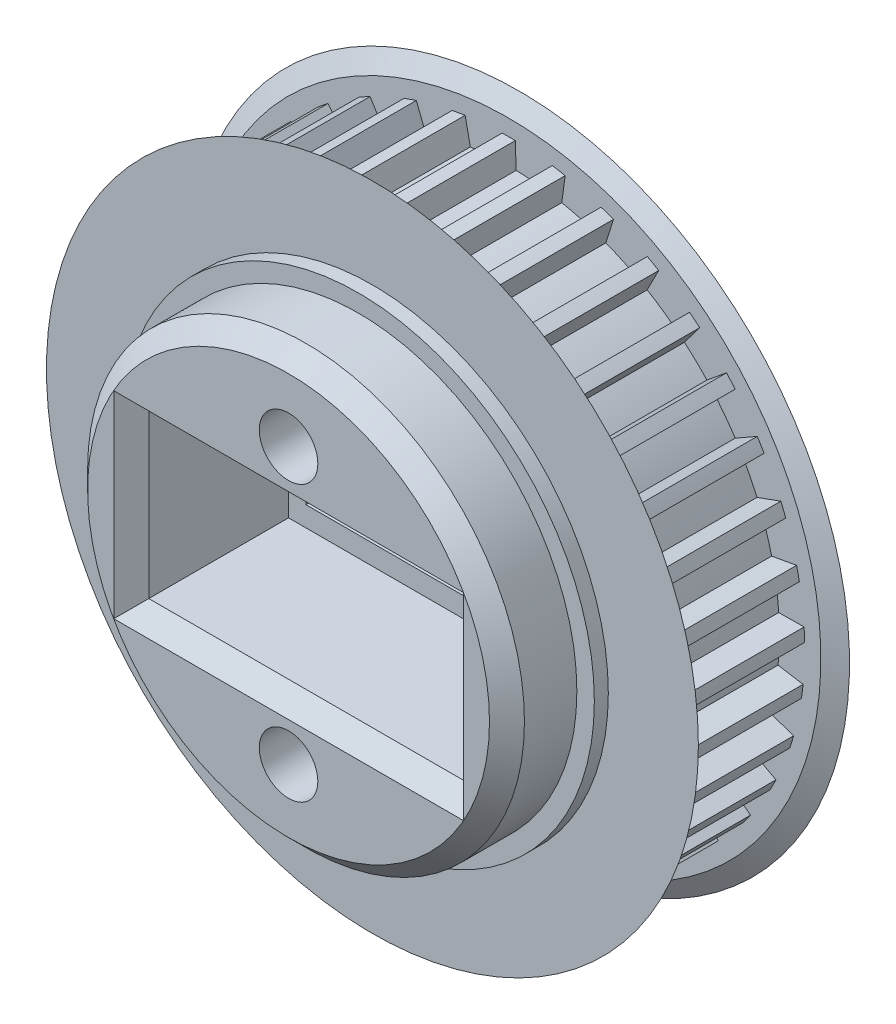
from build123d import *
from build123d.topology import SkipClean

# Parameters (mm, degrees)
CROQUIS1_R                 = 2
SALIENTE_EXTRUIR1_DEPTH    = 7.2
CROQUIS2_R                 = 19
CROQUIS2_R_2               = 2
SALIENTE_EXTRUIR2_DEPTH    = 0.6
SALIENTE_EXTRUIR4_START    = 5.8
CROQUIS4_R                 = 12.45
CROQUIS4_R_2               = 2
SALIENTE_EXTRUIR4_DEPTH    = 5.8
SALIENTE_EXTRUIR6_START    = 0.6
CROQUIS6_R                 = 19.25
CROQUIS6_R_2               = 2
SALIENTE_EXTRUIR6_DEPTH    = 0.6
SALIENTE_EXTRUIR5_START    = 0.6
CROQUIS5_R                 = 13.5
CROQUIS5_R_2               = 2
SALIENTE_EXTRUIR5_DEPTH    = 0.6
CHAFL_N2_SIZE              = 1.385640646
CHAFL_N2_SIZE_2            = 0.8
CROQUIS3_R                 = 12.5
CROQUIS3_R_2               = 2
SALIENTE_EXTRUIR7_DEPTH    = 4.8
CHAFL_N4_SIZE              = 1
CROQUIS7_R                 = 13.5
CROQUIS7_R_2               = 2
SALIENTE_EXTRUIR8_DEPTH    = 0.8
CORTAR_EXTRUIR1_DEPTH      = 30.554211503
CORTAR_EXTRUIR1_DEPTH_BACK = 30.554211503
CROQUIS8_R                 = 1.675
CROQUIS8_W                 = 16
CROQUIS8_H                 = 7
CORTAR_EXTRUIR2_DEPTH      = 4
REDONDEO1_R                = 2.5
CROQUIS10_W                = 18
CROQUIS10_H                = 9.3
CORTAR_EXTRUIR3_DEPTH      = 9
CHAFL_N5_SIZE              = 1


with BuildPart() as part:
    # Croquis1 → Saliente-Extruir1 (new body)
    with BuildSketch(Plane.XY):
        with BuildLine():
            Line((-0.375, 16.933844216), (-0.425, 15.482163668))
            ThreePointArc((-0.425, 15.482163668), (-1.31347381, 15.432200212), (-2.197611598, 15.331292186))
            Line((-2.197611598, 15.331292186), (-2.492227597, 16.75364159))
            Line((-2.492227597, 16.75364159), (-3.23143953, 16.626890975))
            Line((-3.23143953, 16.626890975), (-3.035385122, 15.187641489))
            ThreePointArc((-3.035385122, 15.187641489), (-3.90263518, 14.988243909), (-4.757001912, 14.739367342))
            Line((-4.757001912, 14.739367342), (-5.287758344, 16.091467199))
            ThreePointArc((-5.287758344, 16.091467199), (-5.642720476, 15.970454301), (-5.994916428, 15.841612353))
            Line((-5.994916428, 15.841612353), (-5.558447741, 14.456198517))
            ThreePointArc((-5.558447741, 14.456198517), (-6.379524842, 14.113103118), (-7.179541942, 13.723417735))
            Line((-7.179541942, 13.723417735), (-7.931169911, 14.966370595))
            ThreePointArc((-7.931169911, 14.966370595), (-8.260574956, 14.787109465), (-8.585930496, 14.600599387))
            Line((-8.585930496, 14.600599387), (-7.921603938, 13.308877033))
            ThreePointArc((-7.921603938, 13.308877033), (-8.672887189, 12.831954046), (-9.395539622, 12.312670387))
            Line((-9.395539622, 12.312670387), (-10.34641616, 13.410718757))
            ThreePointArc((-10.34641616, 13.410718757), (-10.640787735, 13.178366413), (-10.929942975, 12.939553759))
            Line((-10.929942975, 12.939553759), (-10.056870013, 11.778683389))
            ThreePointArc((-10.056870013, 11.778683389), (-10.716746362, 11.181653019), (-11.341244733, 10.547709928))
            Line((-11.341244733, 10.547709928), (-12.464014853, 11.469264958))
            ThreePointArc((-12.464014853, 11.469264958), (-12.714884425, 11.190505753), (-12.959520896, 10.906260729))
            Line((-12.959520896, 10.906260729), (-11.902818248, 9.909638469))
            ThreePointArc((-11.902818248, 9.909638469), (-12.452304255, 9.209676194), (-12.960682883, 8.47931106))
            Line((-12.960682883, 8.47931106), (-14.223046532, 9.197861288))
            ThreePointArc((-14.223046532, 9.197861288), (-14.423197039, 8.880714617), (-14.616276995, 8.559214434))
            Line((-14.616276995, 8.559214434), (-13.406344074, 7.755511293))
            ThreePointArc((-13.406344074, 7.755511293), (-13.829632025, 6.972753752), (-14.207265783, 6.16697785))
            Line((-14.207265783, 6.16697785), (-15.572907059, 6.661851895))
            ThreePointArc((-15.572907059, 6.661851895), (-15.716580535, 6.31544149), (-15.852549417, 5.965935124))
            Line((-15.852549417, 5.965935124), (-14.524193789, 5.378272177))
            ThreePointArc((-14.524193789, 5.378272177), (-14.809106462, 4.535237879), (-15.045131514, 3.677231916))
            Line((-15.045131514, 3.677231916), (-16.474763403, 3.934193152))
            ThreePointArc((-16.474763403, 3.934193152), (-16.557826624, 3.56848461), (-16.632772855, 3.201026723))
            Line((-16.632772855, 3.201026723), (-15.224208894, 2.846309963))
            ThreePointArc((-15.224208894, 2.846309963), (-15.362549869, 1.967251471), (-15.450176204, 1.081698715))
            Line((-15.450176204, 1.081698715), (-16.902670799, 1.093354836))
            ThreePointArc((-16.902670799, 1.093354836), (-16.922734188, 0.718868926), (-16.934501701, 0.344030611))
            Line((-16.934501701, 0.344030611), (-15.486251227, 0.232464594))
            ThreePointArc((-15.486251227, 0.232464594), (-15.474040687, -0.657329181), (-15.410747454, -1.544952989))
            Line((-15.410747454, -1.544952989), (-16.844319131, -1.778937309))
            ThreePointArc((-16.844319131, -1.778937309), (-16.800805501, -2.151427309), (-16.749055766, -2.522862635))
            Line((-16.749055766, -2.522862635), (-15.302782308, -2.388068359))
            ThreePointArc((-15.302782308, -2.388068359), (-15.140371528, -3.262999669), (-14.927979559, -4.127159208))
            Line((-14.927979559, -4.127159208), (-16.30138707, -4.600052666))
            ThreePointArc((-16.30138707, -4.600052666), (-16.195548228, -4.959830898), (-16.081769991, -5.317177717))
            Line((-16.081769991, -5.317177717), (-14.679080203, -4.939900933))
            ThreePointArc((-14.679080203, -4.939900933), (-14.371141446, -5.774799597), (-14.015760871, -6.590634571))
            Line((-14.015760871, -6.590634571), (-15.289493783, -7.288832883))
            ThreePointArc((-15.289493783, -7.288832883), (-15.12437452, -7.625549182), (-14.951840974, -7.958527277))
            Line((-14.951840974, -7.958527277), (-13.633087688, -7.349621551))
            ThreePointArc((-13.633087688, -7.349621551), (-13.18847979, -8.120469055), (-12.700334261, -8.864509377))
            Line((-12.700334261, -8.864509377), (-13.837749597, -9.767926649))
            ThreePointArc((-13.837749597, -9.767926649), (-13.618100094, -10.071894299), (-13.391774715, -10.370924497))
            Line((-13.391774715, -10.370924497), (-12.194896061, -9.547906938))
            ThreePointArc((-12.194896061, -9.547906938), (-11.626409582, -10.232527404), (-11.019542158, -10.883368388))
            Line((-11.019542158, -10.883368388), (-11.98791855, -11.96601495))
            ThreePointArc((-11.98791855, -11.96601495), (-11.720057722, -12.228489356), (-11.446451479, -12.484969102))
            Line((-11.446451479, -12.484969102), (-10.405879478, -11.471516427))
            ThreePointArc((-10.405879478, -11.471516427), (-9.729868739, -12.050214569), (-9.02173789, -12.589132706))
            Line((-9.02173789, -12.589132706), (-9.793216912, -13.819862787))
            ThreePointArc((-9.793216912, -13.819862787), (-9.484850629, -14.033293038), (-9.171834675, -14.239843877))
            Line((-9.171834675, -14.239843877), (-8.317504688, -13.065111274))
            ThreePointArc((-8.317504688, -13.065111274), (-7.553417288, -13.521239001), (-6.764394649, -13.932730597))
            Line((-6.764394649, -13.932730597), (-7.316782254, -15.276138333))
            ThreePointArc((-7.316782254, -15.276138333), (-6.976781652, -15.434384429), (-6.633360886, -15.58506427))
            Line((-6.633360886, -15.58506427), (-5.989850432, -14.282846658))
            ThreePointArc((-5.989850432, -14.282846658), (-5.159667773, -14.603282005), (-4.31245209, -14.875509195))
            Line((-4.31245209, -14.875509195), (-4.629857092, -16.292947193))
            ThreePointArc((-4.629857092, -16.292947193), (-4.268003369, -16.391456682), (-3.904057382, -16.481930739))
            Line((-3.904057382, -16.481930739), (-3.489879085, -15.089690547))
            ThreePointArc((-3.489879085, -15.089690547), (-2.617484011, -15.265215173), (-1.736448135, -15.390346478))
            Line((-1.736448135, -15.390346478), (-1.809739372, -16.841037627))
            ThreePointArc((-1.809739372, -16.841037627), (-1.436442401, -16.876976571), (-1.062441255, -16.90464207))
            Line((-1.062441255, -16.90464207), (-0.88951027, -15.462431514))
            ThreePointArc((-0.88951027, -15.462431514), (0, -15.487995895), (0.88951027, -15.462431514))
            Line((0.88951027, -15.462431514), (1.062441255, -16.90464207))
            ThreePointArc((1.062441255, -16.90464207), (1.436442401, -16.876976571), (1.809739372, -16.841037627))
            Line((1.809739372, -16.841037627), (1.736448135, -15.390346478))
            ThreePointArc((1.736448135, -15.390346478), (2.617484011, -15.265215173), (3.489879085, -15.089690547))
            Line((3.489879085, -15.089690547), (3.904057382, -16.481930739))
            ThreePointArc((3.904057382, -16.481930739), (4.268003369, -16.391456682), (4.629857092, -16.292947193))
            Line((4.629857092, -16.292947193), (4.31245209, -14.875509195))
            ThreePointArc((4.31245209, -14.875509195), (5.159667773, -14.603282005), (5.989850432, -14.282846658))
            Line((5.989850432, -14.282846658), (6.633360886, -15.58506427))
            ThreePointArc((6.633360886, -15.58506427), (6.976781652, -15.434384429), (7.316782254, -15.276138333))
            Line((7.316782254, -15.276138333), (6.764394649, -13.932730597))
            ThreePointArc((6.764394649, -13.932730597), (7.553417288, -13.521239001), (8.317504688, -13.065111274))
            Line((8.317504688, -13.065111274), (9.171834675, -14.239843877))
            ThreePointArc((9.171834675, -14.239843877), (9.484850629, -14.033293038), (9.793216912, -13.819862787))
            Line((9.793216912, -13.819862787), (9.02173789, -12.589132706))
            ThreePointArc((9.02173789, -12.589132706), (9.729868739, -12.050214569), (10.405879478, -11.471516427))
            Line((10.405879478, -11.471516427), (11.446451479, -12.484969102))
            ThreePointArc((11.446451479, -12.484969102), (11.720057722, -12.228489356), (11.98791855, -11.96601495))
            Line((11.98791855, -11.96601495), (11.019542158, -10.883368388))
            ThreePointArc((11.019542158, -10.883368388), (11.626409582, -10.232527404), (12.194896061, -9.547906938))
            Line((12.194896061, -9.547906938), (13.391774715, -10.370924497))
            ThreePointArc((13.391774715, -10.370924497), (13.618100094, -10.071894299), (13.837749597, -9.767926649))
            Line((13.837749597, -9.767926649), (12.700334261, -8.864509377))
            ThreePointArc((12.700334261, -8.864509377), (13.18847979, -8.120469055), (13.633087688, -7.349621551))
            Line((13.633087688, -7.349621551), (14.951840974, -7.958527277))
            ThreePointArc((14.951840974, -7.958527277), (15.12437452, -7.625549182), (15.289493783, -7.288832883))
            Line((15.289493783, -7.288832883), (14.015760871, -6.590634571))
            ThreePointArc((14.015760871, -6.590634571), (14.371141446, -5.774799597), (14.679080203, -4.939900933))
            Line((14.679080203, -4.939900933), (16.081769991, -5.317177717))
            ThreePointArc((16.081769991, -5.317177717), (16.195548228, -4.959830898), (16.30138707, -4.600052666))
            Line((16.30138707, -4.600052666), (14.927979559, -4.127159208))
            ThreePointArc((14.927979559, -4.127159208), (15.140371528, -3.262999669), (15.302782308, -2.388068359))
            Line((15.302782308, -2.388068359), (16.749055766, -2.522862635))
            ThreePointArc((16.749055766, -2.522862635), (16.800805501, -2.151427309), (16.844319131, -1.778937309))
            Line((16.844319131, -1.778937309), (15.410747454, -1.544952989))
            ThreePointArc((15.410747454, -1.544952989), (15.474040687, -0.657329181), (15.486251227, 0.232464594))
            Line((15.486251227, 0.232464594), (16.934501701, 0.344030611))
            ThreePointArc((16.934501701, 0.344030611), (16.922734188, 0.718868926), (16.902670799, 1.093354836))
            Line((16.902670799, 1.093354836), (15.450176204, 1.081698715))
            ThreePointArc((15.450176204, 1.081698715), (15.362549869, 1.967251471), (15.224208894, 2.846309963))
            Line((15.224208894, 2.846309963), (16.632772855, 3.201026723))
            ThreePointArc((16.632772855, 3.201026723), (16.557826624, 3.56848461), (16.474763403, 3.934193152))
            Line((16.474763403, 3.934193152), (15.045131514, 3.677231916))
            ThreePointArc((15.045131514, 3.677231916), (14.809106462, 4.535237879), (14.524193789, 5.378272177))
            Line((14.524193789, 5.378272177), (15.852549417, 5.965935124))
            ThreePointArc((15.852549417, 5.965935124), (15.716580535, 6.31544149), (15.572907059, 6.661851895))
            Line((15.572907059, 6.661851895), (14.207265783, 6.16697785))
            ThreePointArc((14.207265783, 6.16697785), (13.829632025, 6.972753752), (13.406344074, 7.755511293))
            Line((13.406344074, 7.755511293), (14.616276995, 8.559214434))
            ThreePointArc((14.616276995, 8.559214434), (14.423197039, 8.880714617), (14.223046532, 9.197861288))
            Line((14.223046532, 9.197861288), (12.960682883, 8.47931106))
            ThreePointArc((12.960682883, 8.47931106), (12.452304255, 9.209676194), (11.902818248, 9.909638469))
            Line((11.902818248, 9.909638469), (12.959520896, 10.906260729))
            ThreePointArc((12.959520896, 10.906260729), (12.714884425, 11.190505753), (12.464014853, 11.469264958))
            Line((12.464014853, 11.469264958), (11.341244733, 10.547709928))
            ThreePointArc((11.341244733, 10.547709928), (10.716746362, 11.181653019), (10.056870013, 11.778683389))
            Line((10.056870013, 11.778683389), (10.929942975, 12.939553759))
            ThreePointArc((10.929942975, 12.939553759), (10.640787735, 13.178366413), (10.34641616, 13.410718757))
            Line((10.34641616, 13.410718757), (9.395539622, 12.312670387))
            ThreePointArc((9.395539622, 12.312670387), (8.672887189, 12.831954046), (7.921603938, 13.308877033))
            Line((7.921603938, 13.308877033), (8.585930496, 14.600599387))
            ThreePointArc((8.585930496, 14.600599387), (8.260574956, 14.787109465), (7.931169911, 14.966370595))
            Line((7.931169911, 14.966370595), (7.179541942, 13.723417735))
            ThreePointArc((7.179541942, 13.723417735), (6.379524842, 14.113103118), (5.558447741, 14.456198517))
            Line((5.558447741, 14.456198517), (5.994916428, 15.841612353))
            ThreePointArc((5.994916428, 15.841612353), (5.642720476, 15.970454301), (5.287758344, 16.091467199))
            Line((5.287758344, 16.091467199), (4.757001912, 14.739367342))
            ThreePointArc((4.757001912, 14.739367342), (3.90263518, 14.988243909), (3.035385122, 15.187641489))
            Line((3.035385122, 15.187641489), (3.23143953, 16.626890975))
            ThreePointArc((3.23143953, 16.626890975), (2.862535201, 16.694358243), (2.492227597, 16.75364159))
            Line((2.492227597, 16.75364159), (2.197611598, 15.331292186))
            ThreePointArc((2.197611598, 15.331292186), (1.31347381, 15.432200212), (0.425, 15.482163668))
            Line((0.425, 15.482163668), (0.375, 16.933844216))
            ThreePointArc((0.375, 16.933844216), (0, 16.937995895), (-0.375, 16.933844216))
        make_face()
        Circle(CROQUIS1_R, mode=Mode.SUBTRACT)
    extrude(amount=SALIENTE_EXTRUIR1_DEPTH)

    # Croquis2 → Saliente-Extruir2 (add)
    with BuildSketch(Plane.XY.offset(7.2)):
        Circle(CROQUIS2_R)
        Circle(CROQUIS2_R_2, mode=Mode.SUBTRACT)
    extrude(amount=SALIENTE_EXTRUIR2_DEPTH)

    # Croquis4 → Saliente-Extruir4 (add)
    with BuildSketch(Plane(origin=(0, 0, 0), x_dir=(-1, 0, 0), z_dir=(0, 0, -1)).offset(SALIENTE_EXTRUIR4_START)):
        with Locations(Location((0, 0, 0), (0, 0, 180))):
            Circle(CROQUIS4_R)
        Circle(CROQUIS4_R_2, mode=Mode.SUBTRACT)
    extrude(amount=-SALIENTE_EXTRUIR4_DEPTH)

    # Croquis6 → Saliente-Extruir6 (add)
    with SkipClean():  # the faces are left unmerged after this step: merging them gives an invalid solid
        with BuildSketch(Plane(origin=(0, 0, 0), x_dir=(-1, 0, 0), z_dir=(0, 0, -1)).offset(SALIENTE_EXTRUIR6_START)):
            Circle(CROQUIS6_R)
            Circle(CROQUIS6_R_2, mode=Mode.SUBTRACT)
        extrude(amount=-SALIENTE_EXTRUIR6_DEPTH)

    # Croquis5 → Saliente-Extruir5 (add)
    with SkipClean():  # the faces are left unmerged after this step: merging them gives an invalid solid
        with BuildSketch(Plane(origin=(0, 0, -0.6), x_dir=(-1, 0, 0), z_dir=(0, 0, -1)).offset(SALIENTE_EXTRUIR5_START)):
            Circle(CROQUIS5_R)
            Circle(CROQUIS5_R_2, mode=Mode.SUBTRACT)
        extrude(amount=-SALIENTE_EXTRUIR5_DEPTH)

    # Chaflán2
    # the kernel refuses this chamfer: 1.385640646, 0.8 mm, written as the material it takes off along each edge
    with BuildSketch(Plane(origin=(0, 0, 0), x_dir=(-1, 0, 0), z_dir=(0, -1, 0))) as chafl_n2_piece_1:
        Polygon((19.25 - CHAFL_N2_SIZE, 0), (19.25, CHAFL_N2_SIZE_2), (19.25, 0), align=None)
    revolve(axis=Axis((0, 0, 0), (0, 0, -1)), mode=Mode.SUBTRACT)
    with BuildSketch(Plane(origin=(0, 0, 7.2), x_dir=(1, 0, 0), z_dir=(0, -1, 0))) as chafl_n2_piece_2:
        Polygon((19 - CHAFL_N2_SIZE, 0), (19, CHAFL_N2_SIZE_2), (19, 0), align=None)
    revolve(axis=Axis((0, 0, 7.2), (0, 0, 1)), mode=Mode.SUBTRACT)

    # Croquis3 → Saliente-Extruir7 (add)
    with BuildSketch(Plane.XY.offset(7.8)):
        Circle(CROQUIS3_R)
        with Locations(Location((0, 0, 0), (0, 0, 180))):
            Circle(CROQUIS3_R_2, mode=Mode.SUBTRACT)
    extrude(amount=SALIENTE_EXTRUIR7_DEPTH)

    # Chaflán4
    chafl_n4_edges = [part.edges().sort_by_distance(p)[0] for p in [
        (-12.45, 0, -5.8),
        (-12.5, 0, 12.6),
    ]]
    chamfer(chafl_n4_edges, length=CHAFL_N4_SIZE)

    # Croquis7 → Saliente-Extruir8 (add)
    with BuildSketch(Plane.XY.offset(7.8)):
        with Locations(Location((0, 0, 0), (0, 0, 180))):
            Circle(CROQUIS7_R)
        with Locations(Location((0, 0, 0), (0, 0, 180))):
            Circle(CROQUIS7_R_2, mode=Mode.SUBTRACT)
    extrude(amount=SALIENTE_EXTRUIR8_DEPTH)

    # Croquis8 → Cortar-Extruir1 (cut, two sides: drawn at the far end of the back side and taken through both)
    with BuildSketch(Plane.XY.offset(-CORTAR_EXTRUIR1_DEPTH_BACK)):
        with Locations((0, 7.875631857)):
            Circle(CROQUIS8_R)
        with Locations((0, -7.875631857)):
            Circle(CROQUIS8_R)
        Rectangle(CROQUIS8_W, CROQUIS8_H)
    extrude(amount=CORTAR_EXTRUIR1_DEPTH + CORTAR_EXTRUIR1_DEPTH_BACK, mode=Mode.SUBTRACT)

    # Croquis9 → Cortar-Extruir2 (cut)
    with BuildSketch(Plane(origin=(0, 0, -5.8), x_dir=(-1, 0, 0), z_dir=(0, 0, -1))):
        Polygon((2.33826859, 3.825631857), (4.67653718, 7.875631857), (2.33826859, 11.925631857), (-2.33826859, 11.925631857), (-4.67653718, 7.875631857), (-2.33826859, 3.825631857), align=None)
        Polygon((2.33826859, -11.925631857), (4.67653718, -7.875631857), (2.33826859, -3.825631857), (-2.33826859, -3.825631857), (-4.67653718, -7.875631857), (-2.33826859, -11.925631857), align=None)
    extrude(amount=-CORTAR_EXTRUIR2_DEPTH, mode=Mode.SUBTRACT)

    # Redondeo1
    redondeo1_edges = [part.edges().sort_by_distance(p)[0] for p in [
        (0, 3.825631857, -1.8),
        (3.507402885, 5.850631857, -1.8),
        (3.507402885, 9.900631857, -1.8),
        (0, 11.925631857, -1.8),
        (-3.507402885, 9.900631857, -1.8),
        (-3.507402885, 5.850631857, -1.8),
        (0, -11.925631857, -1.8),
        (3.507402885, -9.900631857, -1.8),
        (3.507402885, -5.850631857, -1.8),
        (0, -3.825631857, -1.8),
        (-3.507402885, -5.850631857, -1.8),
        (-3.507402885, -9.900631857, -1.8),
    ]]
    fillet(redondeo1_edges, radius=REDONDEO1_R)

    # Croquis10 → Cortar-Extruir3 (cut)
    with BuildSketch(Plane.XY.offset(12.6)):
        Rectangle(CROQUIS10_W, CROQUIS10_H)
    extrude(amount=-CORTAR_EXTRUIR3_DEPTH, mode=Mode.SUBTRACT)

    # Chaflán5
    # the kernel refuses this chamfer: 1 mm, written as the material it takes off along each edge
    with BuildSketch(Plane(origin=(-8, -3.5, -5.8), x_dir=(-0.9996219169112968, 0, -0.02749587661058651), z_dir=(0, 1, 0)), Plane(origin=(8, 3.5, -5.8), x_dir=(0.9996219169112968, 0, -0.02749587661058651), z_dir=(0, -1, 0))) as chafl_n5_piece_1:
        Polygon((CHAFL_N5_SIZE * 0.999621916911, CHAFL_N5_SIZE * 0.0274958766106), (-CHAFL_N5_SIZE * 0.0274958766106, CHAFL_N5_SIZE * 0.999621916911), (0, 0), align=None)
    extrude(amount=7, mode=Mode.SUBTRACT)
    with BuildSketch(Plane(origin=(-8, 3.5, -5.8), x_dir=(0, 0.9996219169112968, -0.027495876610586487), z_dir=(1, 0, 0)), Plane(origin=(8, -3.5, -5.8), x_dir=(0, -0.9996219169112968, -0.027495876610586497), z_dir=(-1, 0, 0))) as chafl_n5_piece_2:
        Polygon((CHAFL_N5_SIZE * 0.999621916911, CHAFL_N5_SIZE * 0.0274958766106), (-CHAFL_N5_SIZE * 0.0274958766106, CHAFL_N5_SIZE * 0.999621916911), (0, 0), align=None)
    extrude(amount=16, mode=Mode.SUBTRACT)
    with BuildSketch(Plane(origin=(9, -4.65, 12.6), x_dir=(0.9996219169112968, 0, 0.027495876610585647), z_dir=(0, 1, 0)), Plane(origin=(-9, 4.65, 12.6), x_dir=(-0.9996219169112968, 0, 0.027495876610585647), z_dir=(0, -1, 0))) as chafl_n5_piece_3:
        Polygon((CHAFL_N5_SIZE * 0.999621916911, CHAFL_N5_SIZE * 0.0274958766106), (-CHAFL_N5_SIZE * 0.0274958766106, CHAFL_N5_SIZE * 0.999621916911), (0, 0), align=None)
    extrude(amount=9.3, mode=Mode.SUBTRACT)
    with BuildSketch(Plane(origin=(9, 4.65, 12.6), x_dir=(0, 0.9996219169112968, 0.027495876610585623), z_dir=(-1, 0, 0)), Plane(origin=(-9, -4.65, 12.6), x_dir=(0, -0.9996219169112968, 0.027495876610585623), z_dir=(1, 0, 0))) as chafl_n5_piece_4:
        Polygon((CHAFL_N5_SIZE * 0.999621916911, CHAFL_N5_SIZE * 0.0274958766106), (-CHAFL_N5_SIZE * 0.0274958766106, CHAFL_N5_SIZE * 0.999621916911), (0, 0), align=None)
    extrude(amount=18, mode=Mode.SUBTRACT)
    with BuildSketch(Plane(origin=(-8, -6.071682988, -5.8), x_dir=(-0.9996219169112968, 0, -0.02749587661058651), z_dir=(0, 1, 0))) as chafl_n5_piece_5a_section:
        Polygon((CHAFL_N5_SIZE * 0.999621916911, CHAFL_N5_SIZE * 0.0274958766106), (-CHAFL_N5_SIZE * 0.0274958766106, CHAFL_N5_SIZE * 0.999621916911), (0, 0), align=None)
    chafl_n5_piece_5a = extrude(amount=9.571682988, mode=Mode.PRIVATE)
    chafl_n5_piece_5a = split(chafl_n5_piece_5a, bisect_by=Plane(origin=(-8.329793627, -3.5, -5.470206373), z_dir=(0, -1, 0)), keep=Keep.TOP, mode=Mode.PRIVATE)
    with BuildSketch(Plane(origin=(8, -3.5, -5.8), x_dir=(0, -0.9996219169112968, -0.027495876610586497), z_dir=(-1, 0, 0))) as chafl_n5_piece_5b_section:
        Polygon((CHAFL_N5_SIZE * 0.999621916911, CHAFL_N5_SIZE * 0.0274958766106), (-CHAFL_N5_SIZE * 0.0274958766106, CHAFL_N5_SIZE * 0.999621916911), (0, 0), align=None)
    chafl_n5_piece_5b = extrude(amount=18.571682988, mode=Mode.PRIVATE)
    chafl_n5_piece_5b = split(chafl_n5_piece_5b, bisect_by=Plane(origin=(-8, -3.829793627, -5.470206373), z_dir=(-1, 0, 0)), keep=Keep.TOP, mode=Mode.PRIVATE)
    chafl_n5_piece_5 = chafl_n5_piece_5a & chafl_n5_piece_5b
    add(chafl_n5_piece_5, mode=Mode.SUBTRACT)
    with BuildSketch(Plane(origin=(-10.571682988, 3.5, -5.8), x_dir=(0, 0.9996219169112968, -0.027495876610586487), z_dir=(1, 0, 0))) as chafl_n5_piece_6a_section:
        Polygon((CHAFL_N5_SIZE * 0.999621916911, CHAFL_N5_SIZE * 0.0274958766106), (-CHAFL_N5_SIZE * 0.0274958766106, CHAFL_N5_SIZE * 0.999621916911), (0, 0), align=None)
    chafl_n5_piece_6a = extrude(amount=18.571682988, mode=Mode.PRIVATE)
    chafl_n5_piece_6a = split(chafl_n5_piece_6a, bisect_by=Plane(origin=(-8, 3.829793627, -5.470206373), z_dir=(-1, 0, 0)), keep=Keep.TOP, mode=Mode.PRIVATE)
    with BuildSketch(Plane(origin=(-8, -3.5, -5.8), x_dir=(-0.9996219169112968, 0, -0.02749587661058651), z_dir=(0, 1, 0))) as chafl_n5_piece_6b_section:
        Polygon((CHAFL_N5_SIZE * 0.999621916911, CHAFL_N5_SIZE * 0.0274958766106), (-CHAFL_N5_SIZE * 0.0274958766106, CHAFL_N5_SIZE * 0.999621916911), (0, 0), align=None)
    chafl_n5_piece_6b = extrude(amount=9.571682988, mode=Mode.PRIVATE)
    chafl_n5_piece_6b = split(chafl_n5_piece_6b, bisect_by=Plane(origin=(-8.329793627, 3.5, -5.470206373), z_dir=(0, 1, 0)), keep=Keep.TOP, mode=Mode.PRIVATE)
    chafl_n5_piece_6 = chafl_n5_piece_6a & chafl_n5_piece_6b
    add(chafl_n5_piece_6, mode=Mode.SUBTRACT)
    with BuildSketch(Plane(origin=(-8, 3.5, -5.8), x_dir=(0, 0.9996219169112968, -0.027495876610586487), z_dir=(1, 0, 0))) as chafl_n5_piece_7a_section:
        Polygon((CHAFL_N5_SIZE * 0.999621916911, CHAFL_N5_SIZE * 0.0274958766106), (-CHAFL_N5_SIZE * 0.0274958766106, CHAFL_N5_SIZE * 0.999621916911), (0, 0), align=None)
    chafl_n5_piece_7a = extrude(amount=18.571682988, mode=Mode.PRIVATE)
    chafl_n5_piece_7a = split(chafl_n5_piece_7a, bisect_by=Plane(origin=(8, 3.829793627, -5.470206373), z_dir=(1, 0, 0)), keep=Keep.TOP, mode=Mode.PRIVATE)
    with BuildSketch(Plane(origin=(8, 6.071682988, -5.8), x_dir=(0.9996219169112968, 0, -0.02749587661058651), z_dir=(0, -1, 0))) as chafl_n5_piece_7b_section:
        Polygon((CHAFL_N5_SIZE * 0.999621916911, CHAFL_N5_SIZE * 0.0274958766106), (-CHAFL_N5_SIZE * 0.0274958766106, CHAFL_N5_SIZE * 0.999621916911), (0, 0), align=None)
    chafl_n5_piece_7b = extrude(amount=9.571682988, mode=Mode.PRIVATE)
    chafl_n5_piece_7b = split(chafl_n5_piece_7b, bisect_by=Plane(origin=(8.329793627, 3.5, -5.470206373), z_dir=(0, 1, 0)), keep=Keep.TOP, mode=Mode.PRIVATE)
    chafl_n5_piece_7 = chafl_n5_piece_7a & chafl_n5_piece_7b
    add(chafl_n5_piece_7, mode=Mode.SUBTRACT)
    with BuildSketch(Plane(origin=(8, 3.5, -5.8), x_dir=(0.9996219169112968, 0, -0.02749587661058651), z_dir=(0, -1, 0))) as chafl_n5_piece_8a_section:
        Polygon((CHAFL_N5_SIZE * 0.999621916911, CHAFL_N5_SIZE * 0.0274958766106), (-CHAFL_N5_SIZE * 0.0274958766106, CHAFL_N5_SIZE * 0.999621916911), (0, 0), align=None)
    chafl_n5_piece_8a = extrude(amount=9.571682988, mode=Mode.PRIVATE)
    chafl_n5_piece_8a = split(chafl_n5_piece_8a, bisect_by=Plane(origin=(8.329793627, -3.5, -5.470206373), z_dir=(0, -1, 0)), keep=Keep.TOP, mode=Mode.PRIVATE)
    with BuildSketch(Plane(origin=(10.571682988, -3.5, -5.8), x_dir=(0, -0.9996219169112968, -0.027495876610586497), z_dir=(-1, 0, 0))) as chafl_n5_piece_8b_section:
        Polygon((CHAFL_N5_SIZE * 0.999621916911, CHAFL_N5_SIZE * 0.0274958766106), (-CHAFL_N5_SIZE * 0.0274958766106, CHAFL_N5_SIZE * 0.999621916911), (0, 0), align=None)
    chafl_n5_piece_8b = extrude(amount=18.571682988, mode=Mode.PRIVATE)
    chafl_n5_piece_8b = split(chafl_n5_piece_8b, bisect_by=Plane(origin=(8, -3.829793627, -5.470206373), z_dir=(1, 0, 0)), keep=Keep.TOP, mode=Mode.PRIVATE)
    chafl_n5_piece_8 = chafl_n5_piece_8a & chafl_n5_piece_8b
    add(chafl_n5_piece_8, mode=Mode.SUBTRACT)
    with BuildSketch(Plane(origin=(-9, -4.65, 12.6), x_dir=(0, -0.9996219169112968, 0.027495876610585623), z_dir=(1, 0, 0))) as chafl_n5_piece_9a_section:
        Polygon((CHAFL_N5_SIZE * 0.999621916911, CHAFL_N5_SIZE * 0.0274958766106), (-CHAFL_N5_SIZE * 0.0274958766106, CHAFL_N5_SIZE * 0.999621916911), (0, 0), align=None)
    chafl_n5_piece_9a = extrude(amount=20.571682988, mode=Mode.PRIVATE)
    chafl_n5_piece_9a = split(chafl_n5_piece_9a, bisect_by=Plane(origin=(9, -4.979793627, 12.270206373), z_dir=(1, 0, 0)), keep=Keep.TOP, mode=Mode.PRIVATE)
    with BuildSketch(Plane(origin=(9, -7.221682988, 12.6), x_dir=(0.9996219169112968, 0, 0.027495876610585647), z_dir=(0, 1, 0))) as chafl_n5_piece_9b_section:
        Polygon((CHAFL_N5_SIZE * 0.999621916911, CHAFL_N5_SIZE * 0.0274958766106), (-CHAFL_N5_SIZE * 0.0274958766106, CHAFL_N5_SIZE * 0.999621916911), (0, 0), align=None)
    chafl_n5_piece_9b = extrude(amount=11.871682988, mode=Mode.PRIVATE)
    chafl_n5_piece_9b = split(chafl_n5_piece_9b, bisect_by=Plane(origin=(9.329793627, -4.65, 12.270206373), z_dir=(0, -1, 0)), keep=Keep.TOP, mode=Mode.PRIVATE)
    chafl_n5_piece_9 = chafl_n5_piece_9a & chafl_n5_piece_9b
    add(chafl_n5_piece_9, mode=Mode.SUBTRACT)
    with BuildSketch(Plane(origin=(11.571682988, 4.65, 12.6), x_dir=(0, 0.9996219169112968, 0.027495876610585623), z_dir=(-1, 0, 0))) as chafl_n5_piece_10a_section:
        Polygon((CHAFL_N5_SIZE * 0.999621916911, CHAFL_N5_SIZE * 0.0274958766106), (-CHAFL_N5_SIZE * 0.0274958766106, CHAFL_N5_SIZE * 0.999621916911), (0, 0), align=None)
    chafl_n5_piece_10a = extrude(amount=20.571682988, mode=Mode.PRIVATE)
    chafl_n5_piece_10a = split(chafl_n5_piece_10a, bisect_by=Plane(origin=(9, 4.979793627, 12.270206373), z_dir=(1, 0, 0)), keep=Keep.TOP, mode=Mode.PRIVATE)
    with BuildSketch(Plane(origin=(9, -4.65, 12.6), x_dir=(0.9996219169112968, 0, 0.027495876610585647), z_dir=(0, 1, 0))) as chafl_n5_piece_10b_section:
        Polygon((CHAFL_N5_SIZE * 0.999621916911, CHAFL_N5_SIZE * 0.0274958766106), (-CHAFL_N5_SIZE * 0.0274958766106, CHAFL_N5_SIZE * 0.999621916911), (0, 0), align=None)
    chafl_n5_piece_10b = extrude(amount=11.871682988, mode=Mode.PRIVATE)
    chafl_n5_piece_10b = split(chafl_n5_piece_10b, bisect_by=Plane(origin=(9.329793627, 4.65, 12.270206373), z_dir=(0, 1, 0)), keep=Keep.TOP, mode=Mode.PRIVATE)
    chafl_n5_piece_10 = chafl_n5_piece_10a & chafl_n5_piece_10b
    add(chafl_n5_piece_10, mode=Mode.SUBTRACT)
    with BuildSketch(Plane(origin=(9, 4.65, 12.6), x_dir=(0, 0.9996219169112968, 0.027495876610585623), z_dir=(-1, 0, 0))) as chafl_n5_piece_11a_section:
        Polygon((CHAFL_N5_SIZE * 0.999621916911, CHAFL_N5_SIZE * 0.0274958766106), (-CHAFL_N5_SIZE * 0.0274958766106, CHAFL_N5_SIZE * 0.999621916911), (0, 0), align=None)
    chafl_n5_piece_11a = extrude(amount=20.571682988, mode=Mode.PRIVATE)
    chafl_n5_piece_11a = split(chafl_n5_piece_11a, bisect_by=Plane(origin=(-9, 4.979793627, 12.270206373), z_dir=(-1, 0, 0)), keep=Keep.TOP, mode=Mode.PRIVATE)
    with BuildSketch(Plane(origin=(-9, 7.221682988, 12.6), x_dir=(-0.9996219169112968, 0, 0.027495876610585647), z_dir=(0, -1, 0))) as chafl_n5_piece_11b_section:
        Polygon((CHAFL_N5_SIZE * 0.999621916911, CHAFL_N5_SIZE * 0.0274958766106), (-CHAFL_N5_SIZE * 0.0274958766106, CHAFL_N5_SIZE * 0.999621916911), (0, 0), align=None)
    chafl_n5_piece_11b = extrude(amount=11.871682988, mode=Mode.PRIVATE)
    chafl_n5_piece_11b = split(chafl_n5_piece_11b, bisect_by=Plane(origin=(-9.329793627, 4.65, 12.270206373), z_dir=(0, 1, 0)), keep=Keep.TOP, mode=Mode.PRIVATE)
    chafl_n5_piece_11 = chafl_n5_piece_11a & chafl_n5_piece_11b
    add(chafl_n5_piece_11, mode=Mode.SUBTRACT)
    with BuildSketch(Plane(origin=(-9, 4.65, 12.6), x_dir=(-0.9996219169112968, 0, 0.027495876610585647), z_dir=(0, -1, 0))) as chafl_n5_piece_12a_section:
        Polygon((CHAFL_N5_SIZE * 0.999621916911, CHAFL_N5_SIZE * 0.0274958766106), (-CHAFL_N5_SIZE * 0.0274958766106, CHAFL_N5_SIZE * 0.999621916911), (0, 0), align=None)
    chafl_n5_piece_12a = extrude(amount=11.871682988, mode=Mode.PRIVATE)
    chafl_n5_piece_12a = split(chafl_n5_piece_12a, bisect_by=Plane(origin=(-9.329793627, -4.65, 12.270206373), z_dir=(0, -1, 0)), keep=Keep.TOP, mode=Mode.PRIVATE)
    with BuildSketch(Plane(origin=(-11.571682988, -4.65, 12.6), x_dir=(0, -0.9996219169112968, 0.027495876610585623), z_dir=(1, 0, 0))) as chafl_n5_piece_12b_section:
        Polygon((CHAFL_N5_SIZE * 0.999621916911, CHAFL_N5_SIZE * 0.0274958766106), (-CHAFL_N5_SIZE * 0.0274958766106, CHAFL_N5_SIZE * 0.999621916911), (0, 0), align=None)
    chafl_n5_piece_12b = extrude(amount=20.571682988, mode=Mode.PRIVATE)
    chafl_n5_piece_12b = split(chafl_n5_piece_12b, bisect_by=Plane(origin=(-9, -4.979793627, 12.270206373), z_dir=(-1, 0, 0)), keep=Keep.TOP, mode=Mode.PRIVATE)
    chafl_n5_piece_12 = chafl_n5_piece_12a & chafl_n5_piece_12b
    add(chafl_n5_piece_12, mode=Mode.SUBTRACT)


solid = part.part
